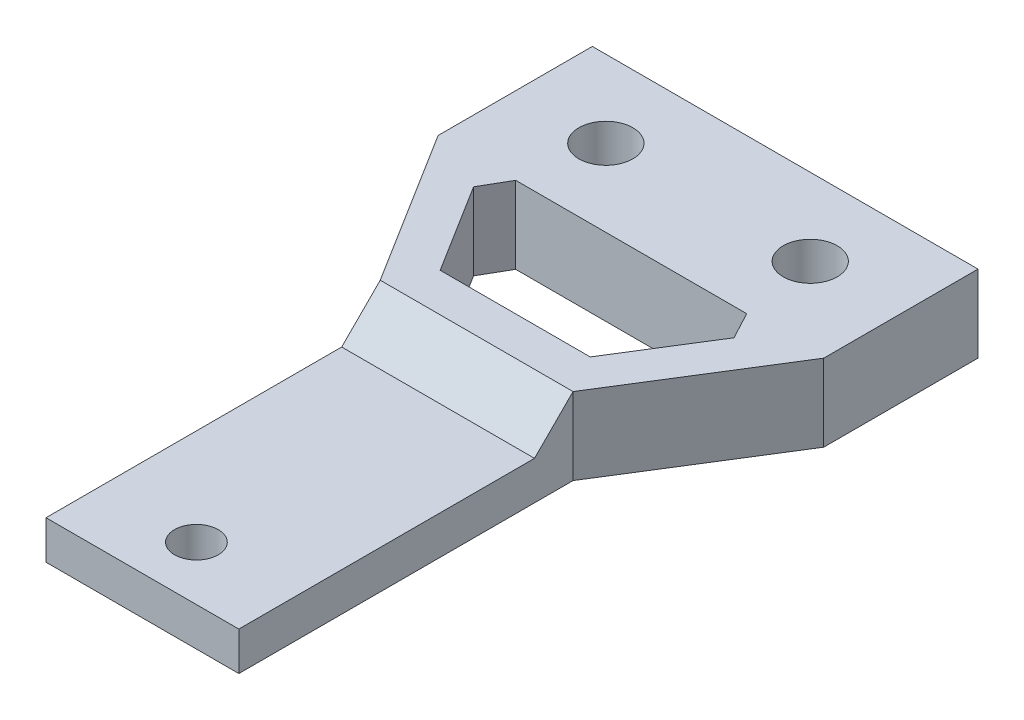
from build123d import *
from OCP.BRepFilletAPI import BRepFilletAPI_MakeChamfer

# Parameters (mm, degrees)
SKETCH1_W           = 15
SKETCH1_H           = 12
BOSS_EXTRUDE1_DEPTH = 6
SKETCH1_3_W         = 15
SKETCH1_3_H         = 26
SKETCH1_3_R         = 1.7
BOSS_EXTRUDE2_DEPTH = 3
CHAMFER1_SIZE       = 3
CUT_EXTRUDE1_DEPTH  = 6
CHAMFER2_SIZE       = 2.5
CHAMFER2_SIZE2      = 2.451963608


with BuildPart() as part:
    # Sketch1 → Boss-Extrude1 (new body)
    with BuildSketch(Plane(origin=(0, 0, 0), x_dir=(-1, 0, 0), z_dir=(0, 1, 0))):
        with BuildLine():
            Line((-7.5, -8), (-15, -8))
            Line((-15, -8), (-15, -20))
            Line((-15, -20), (-7.5, -20))
            Line((-7.5, -20), (-7.5, -16.05121915))
            ThreePointArc((-7.5, -16.05121915), (-10.05, -14), (-7.5, -11.94878085))
            Line((-7.5, -11.94878085), (-7.5, -8))
        make_face()
        with BuildLine():
            Line((7.5, -8), (-7.5, -8))
            Line((-7.5, -8), (-7.5, -11.94878085))
            ThreePointArc((-7.5, -11.94878085), (-6.313693183, -12.683755342), (-5.85, -14))
            ThreePointArc((-5.85, -14), (-6.313693183, -15.316244658), (-7.5, -16.05121915))
            Line((-7.5, -16.05121915), (-7.5, -20))
            Line((-7.5, -20), (7.5, -20))
            Line((7.5, -20), (7.5, -16.05121915))
            ThreePointArc((7.5, -16.05121915), (5.85, -14), (7.5, -11.94878085))
            Line((7.5, -11.94878085), (7.5, -8))
        make_face()
        with BuildLine():
            Line((15, -8), (7.5, -8))
            Line((7.5, -8), (7.5, -11.94878085))
            ThreePointArc((7.5, -11.94878085), (9.266244658, -12.363693183), (10.05, -14))
            ThreePointArc((10.05, -14), (9.266244658, -15.636306817), (7.5, -16.05121915))
            Line((7.5, -16.05121915), (7.5, -20))
            Line((7.5, -20), (15, -20))
            Line((15, -20), (15, -8))
        make_face()
        Polygon((15, -8), (7.5, 4), (7.5, -8), align=None)
        with Locations((0, -2)):
            Rectangle(SKETCH1_W, SKETCH1_H)
        Polygon((-7.5, 4), (-15, -8), (-7.5, -8), align=None)
    extrude(amount=BOSS_EXTRUDE1_DEPTH)

    # Sketch1<3> → Boss-Extrude2 (add)
    with BuildSketch(Plane(origin=(0, 0, 0), x_dir=(-1, 0, 0), z_dir=(0, 1, 0))):
        with Locations((0, 17)):
            Rectangle(SKETCH1_3_W, SKETCH1_3_H)
        with Locations(Location((0, 25.8, 0), (0, 0, 90))):
            Circle(SKETCH1_3_R, mode=Mode.SUBTRACT)
    extrude(amount=BOSS_EXTRUDE2_DEPTH)

    # Chamfer1
    chamfer1_edges = [part.edges().sort_by_distance(p)[0] for p in [
        (0, 3, 4),
    ]]
    chamfer(chamfer1_edges, length=CHAMFER1_SIZE - 0.0001)  # a hair under: the kernel refuses the full size

    # Sketch2 → Cut-Extrude1 (cut)
    with BuildSketch(Plane(origin=(0, 6, 0), x_dir=(-1, 0, 0), z_dir=(0, 1, 0))):
        Polygon((-5.837257075, 1), (-11.462257075, -8), (11.462257075, -8), (5.837257075, 1), align=None)
    extrude(amount=-CUT_EXTRUDE1_DEPTH, mode=Mode.SUBTRACT)

    # Chamfer2: one chamfer whose edges measure the first distance from different faces: ONE call of the kernel's chamfer builder (chamfer() names one face for all edges)
    chamfer2_edges_1 = [part.edges().sort_by_distance(p)[0] for p in [
        (-11.462257075, 3, -8),
    ]]
    chamfer2_side_1 = [part.faces().sort_by_distance(p)[0] for p in [
        (0, 3, -8),
    ]]
    chamfer2_edges_2 = [part.edges().sort_by_distance(p)[0] for p in [
        (11.462257075, 3, -8),
    ]]
    chamfer2_side_2 = [part.faces().sort_by_distance(p)[0] for p in [
        (8.649757075, 3, -3.5),
    ]]
    chamfer2 = BRepFilletAPI_MakeChamfer(part.part.solid().wrapped)
    for e in chamfer2_edges_1:
        chamfer2.Add(CHAMFER2_SIZE, CHAMFER2_SIZE2, e.wrapped, chamfer2_side_1[0].wrapped)  # the first distance lies on this face
    for e in chamfer2_edges_2:
        chamfer2.Add(CHAMFER2_SIZE, CHAMFER2_SIZE2, e.wrapped, chamfer2_side_2[0].wrapped)  # the first distance lies on this face
    add(Compound.cast(chamfer2.Shape()), mode=Mode.REPLACE)


solid = part.part
